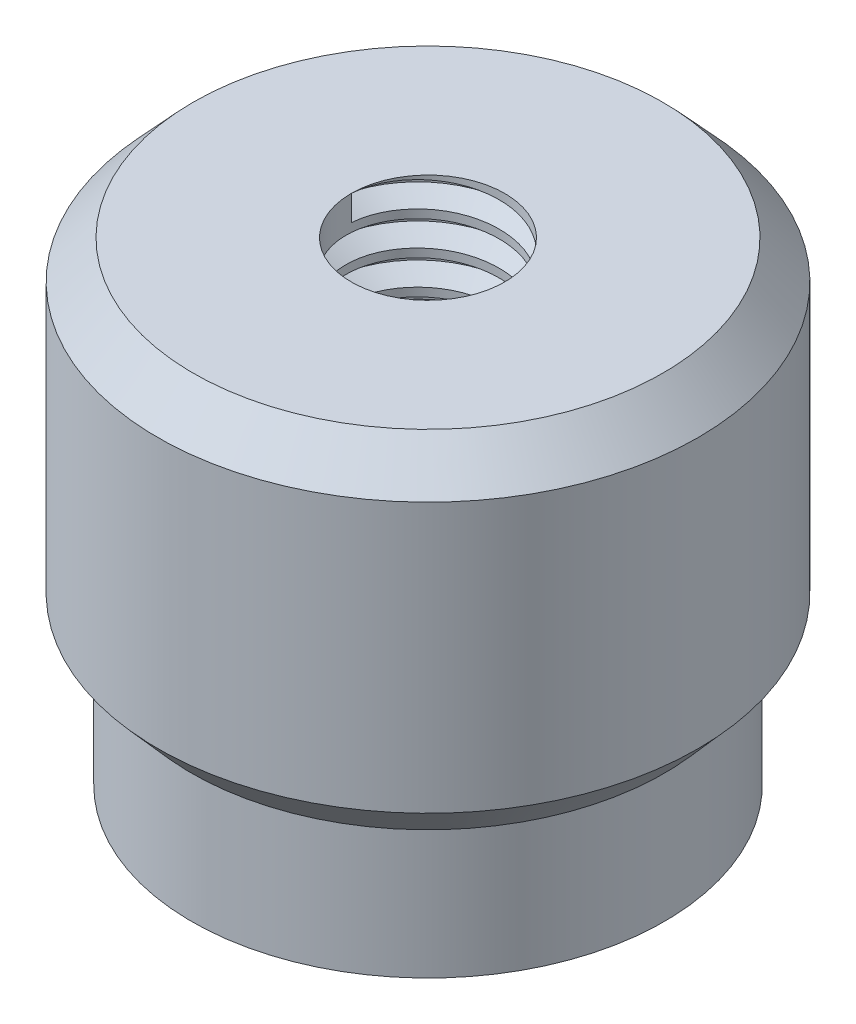
from build123d import *

# Parameters (mm, degrees)
THREAD2_PITCH = 0.79375


with BuildPart() as part:
    # Sketch1 → Revolve3 (revolve)
    with BuildSketch(Plane(origin=(17.370188983, -3.955351675, 0), x_dir=(1, 0, 0), z_dir=(0, 0, 1))):
        Polygon((0.826581205, 3.952974929), (0.826581205, 6.963404787), (0.037665496, 7.856125195), (0.037665496, 14.173064808), (0.864242095, 15.067307541), (4.569307911, 15.067307541), (4.569307911, 3.952974929), align=None)
    revolve(axis=Axis((23.738800614, 15.924406344, 0), (0, -1, 0)))

    # Thread2: the profile of Thread Profile2 profile screwed along a right-hand helix of 13.44 turns, 8 arcs to a turn; built about Z, then put on its axis
    thread2_z = Axis((0, 0, 0), (0, 0, 1))
    thread2_corners = [(1.799003721, 0, -0.000173205), (2.228933509, 0, 0.248046874), (2.228933509, 0, 0.347265624), (1.799003721, 0, 0.595485703)]
    with BuildLine(mode=Mode.PRIVATE) as thread2_profile:
        Line(thread2_corners[0], thread2_corners[1])
        Line(thread2_corners[1], thread2_corners[2])
        Line(thread2_corners[2], thread2_corners[3])
        Line(thread2_corners[3], thread2_corners[0])
    thread2_cap = Face(thread2_profile.wire())
    thread2_turn_angles = [0, 22.5, 45, 67.5, 90, 112.5, 135, 157.5, 180, 202.5, 225, 247.5, 270, 292.5, 315, 337.5, 360]
    thread2_turn_weights = [1, 0.9238795325112867, 1, 0.9238795325112867, 1, 0.9238795325112867, 1, 0.9238795325112867, 1, 0.9238795325112867, 1, 0.9238795325112867, 1, 0.9238795325112867, 1, 0.9238795325112867, 1]
    thread2_turn_rails = [Edge.make_bspline([Vector(p[0], p[1], 0).rotate(thread2_z, thread2_turn_angles[k]) / thread2_turn_weights[k] + Vector(0, 0, p[2] + THREAD2_PITCH * thread2_turn_angles[k] / 360) for k in range(17)], [0, 0, 0, 1, 1, 2, 2, 3, 3, 4, 4, 5, 5, 6, 6, 7, 7, 8, 8, 8], 2, thread2_turn_weights) for p in thread2_corners]
    thread2_turn_sides = [Face.make_surface_from_curves(thread2_turn_rails[p[0]], thread2_turn_rails[p[1]]) for p in [(0, 1), (1, 2), (2, 3), (3, 0)]]
    thread2_last_angles = [4680, 4702.5, 4725, 4747.5, 4770, 4792.5, 4815, 4826.7, 4838.4]
    thread2_last_weights = [1, 0.9238795325112867, 1, 0.9238795325112867, 1, 0.9238795325112867, 1, 0.9792228106217664, 1]
    thread2_last_rails = [Edge.make_bspline([Vector(p[0], p[1], 0).rotate(thread2_z, thread2_last_angles[k]) / thread2_last_weights[k] + Vector(0, 0, p[2] + THREAD2_PITCH * thread2_last_angles[k] / 360) for k in range(9)], [0, 0, 0, 1, 1, 2, 2, 3, 3, 4, 4, 4], 2, thread2_last_weights) for p in thread2_corners]
    thread2_last_sides = [Face.make_surface_from_curves(thread2_last_rails[p[0]], thread2_last_rails[p[1]]) for p in [(0, 1), (1, 2), (2, 3), (3, 0)]]
    thread2 = Plane(origin=(23.738800614, 11.111955866, 0), x_dir=(-1, 0, 0), z_dir=(0, -1, 0)) * Solid(Shell([*[p.moved(Location((0, 0, THREAD2_PITCH * i))) for i in range(13) for p in thread2_turn_sides], *thread2_last_sides, thread2_cap, thread2_cap.rotate(thread2_z, 4838.4).moved(Location((0, 0, THREAD2_PITCH * 4838.4 / 360)))]))
    add(thread2, mode=Mode.SUBTRACT)


solid = part.part
